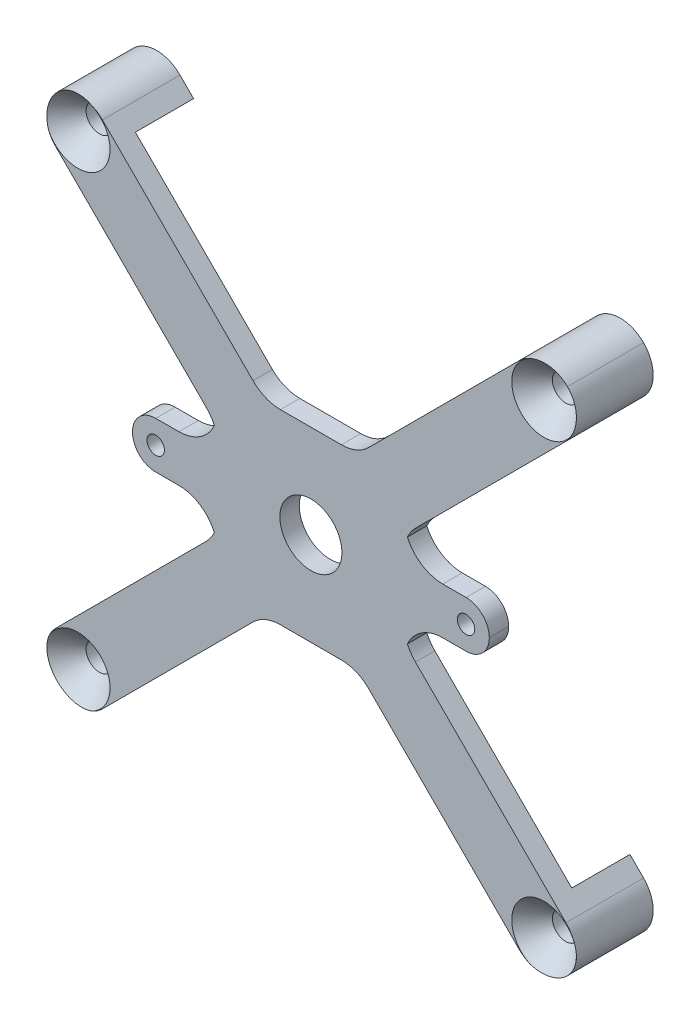
from build123d import *

# Parameters (mm, degrees)
BOSS_EXTRUDE1_DEPTH                            = 10
SKETCH3_W                                      = 46
SKETCH3_H                                      = 6
BOSS_EXTRUDE2_DEPTH                            = 10
CSK_FOR_4_OVAL_HEAD_MACHINE_SCREW1_D           = 3.4544
CSK_FOR_4_OVAL_HEAD_MACHINE_SCREW1_DEPTH       = 25
CSK_FOR_4_OVAL_HEAD_MACHINE_SCREW1_CSINK_D     = 8.3228434
CSK_FOR_4_OVAL_HEAD_MACHINE_SCREW1_CSINK_ANGLE = 82
CSK_FOR_4_OVAL_HEAD_MACHINE_SCREW1_TIP         = 1.037806461
SKETCH7_R                                      = 1.125
CUT_EXTRUDE1_DEPTH                             = 52.725839771
SKETCH8_R                                      = 4
CUT_EXTRUDE2_DEPTH                             = 52.725839771
FILLET1_R                                      = 4.25
FILLET2_R                                      = 3
FILLET3_R                                      = 5
SKETCH9_R                                      = 40
CUT_EXTRUDE3_DEPTH                             = 7.5


# Some blends are built 0.0001 mm under size
with BuildPart() as part:
    # Sketch2 → Boss-Extrude1 (new body)
    with BuildSketch(Plane.XY):
        Polygon((-6, 12.01040764), (-29.875261505, 35.885669145), (-35.885669145, 29.875261505), (-12.01040764, 6), (-12.01040764, -6), (-35.885669145, -29.875261505), (-29.875261505, -35.885669145), (-6, -12.01040764), (6, -12.01040764), (29.875261505, -35.885669145), (35.885669145, -29.875261505), (12.01040764, -6), (12.01040764, 6), (35.885669145, 29.875261505), (29.875261505, 35.885669145), (6, 12.01040764), align=None)
    extrude(amount=BOSS_EXTRUDE1_DEPTH)

    # Sketch3 → Boss-Extrude2 (add)
    with BuildSketch(Plane.XY):
        Rectangle(SKETCH3_W, SKETCH3_H)
    extrude(amount=BOSS_EXTRUDE2_DEPTH)

    # CSK for #4 Oval Head Machine Screw1
    with Locations(Plane.XY.offset(10)):
        with Locations((-30.0520382, 30.0520382), (30.0520382, 30.0520382), (30.0520382, -30.0520382), (-30.0520382, -30.0520382)):
            CounterSinkHole(CSK_FOR_4_OVAL_HEAD_MACHINE_SCREW1_D / 2, CSK_FOR_4_OVAL_HEAD_MACHINE_SCREW1_CSINK_D / 2, depth=CSK_FOR_4_OVAL_HEAD_MACHINE_SCREW1_DEPTH, counter_sink_angle=CSK_FOR_4_OVAL_HEAD_MACHINE_SCREW1_CSINK_ANGLE)
            with Locations((0, 0, -(CSK_FOR_4_OVAL_HEAD_MACHINE_SCREW1_DEPTH + CSK_FOR_4_OVAL_HEAD_MACHINE_SCREW1_TIP / 2))):  # 118° drill point
                Cone(0, CSK_FOR_4_OVAL_HEAD_MACHINE_SCREW1_D / 2, CSK_FOR_4_OVAL_HEAD_MACHINE_SCREW1_TIP, mode=Mode.SUBTRACT)

    # Sketch7 → Cut-Extrude1 (cut, through all)
    with BuildSketch(Plane.XY.offset(10)):
        with Locations((20, 0)):
            Circle(SKETCH7_R)
        with Locations((-20, 0)):
            Circle(SKETCH7_R)
    extrude(amount=-CUT_EXTRUDE1_DEPTH, mode=Mode.SUBTRACT)

    # Sketch8 → Cut-Extrude2 (cut, through all)
    with BuildSketch(Plane.XY.offset(10)):
        Circle(SKETCH8_R)
    extrude(amount=-CUT_EXTRUDE2_DEPTH, mode=Mode.SUBTRACT)

    # Fillet1
    # the kernel refuses this fillet: 4.25 mm, written as the material it takes off along each edge
    with BuildSketch(Plane(origin=(35.885669145, -29.875261505, -10.625), x_dir=(-0.7071067811865225, 0.7071067811865727, 0), z_dir=(0, 0, 1)), Plane(origin=(29.875261505, -35.885669145, -10.625), x_dir=(0.7071067811865693, 0.7071067811865258, 0), z_dir=(0, 0, 1)), Plane(origin=(29.875261505, 35.885669145, -10.625), x_dir=(-0.7071067811865508, -0.7071067811865441, 0), z_dir=(0, 0, 1)), Plane(origin=(35.885669145, 29.875261505, -10.625), x_dir=(-0.7071067811889081, 0.7071067811841868, 0), z_dir=(0, 0, 1))) as fillet1_piece_1:
        with BuildLine():
            CenterArc((FILLET1_R, FILLET1_R), FILLET1_R, 180, 90)
            Line((0, FILLET1_R), (0, 0))
            Line((0, 0), (FILLET1_R, 0))
        make_face()
    extrude(amount=31.25, mode=Mode.SUBTRACT)
    with BuildSketch(Plane(origin=(-29.875261505, 35.885669145, -10.625), x_dir=(0.7071067811862382, -0.7071067811868568, 0), z_dir=(0, 0, 1)), Plane(origin=(-35.885669145, 29.875261505, -10.625), x_dir=(0.7071067811865512, 0.7071067811865438, 0), z_dir=(0, 0, 1)), Plane(origin=(-35.885669145, -29.875261505, -10.625), x_dir=(0.7071067811865503, 0.7071067811865446, 0), z_dir=(0, 0, 1)), Plane(origin=(-29.875261505, -35.885669145, -10.625), x_dir=(-0.7071067811865447, 0.7071067811865505, 0), z_dir=(0, 0, 1))) as fillet1_piece_2:
        with BuildLine():
            CenterArc((FILLET1_R, -FILLET1_R), FILLET1_R, 90, 90)
            Line((0, -FILLET1_R), (0, 0))
            Line((0, 0), (FILLET1_R, 0))
        make_face()
    extrude(amount=31.25, mode=Mode.SUBTRACT)

    # Fillet2
    fillet2_edges = [part.edges().sort_by_distance(p)[0] for p in [
        (23, 3, 5),
        (23, -3, 5),
        (-23, 3, 5),
        (-23, -3, 5),
    ]]
    fillet(fillet2_edges, radius=FILLET2_R - 0.0001)  # a hair under: the kernel refuses the full size

    # Fillet3
    # the kernel refuses this fillet: 5 mm, written as the material it adds along each edge
    with BuildSketch(Plane(origin=(-6, 12.01040764, 0), x_dir=(1, 0, 0), z_dir=(0, 0, 1)), Plane(origin=(6, 12.01040764, 0), x_dir=(0.7071067811865509, 0.707106781186544, 0), z_dir=(0, 0, 1)), Plane(origin=(-12.01040764, 6, 0), x_dir=(-0.7071067811865444, 0.7071067811865508, 0), z_dir=(0, 0, 1)), Plane(origin=(12.01040764, 6, 0), x_dir=(0, -1, 0), z_dir=(0, 0, 1))) as fillet3_piece_1:
        with BuildLine():
            CenterArc((FILLET3_R * 0.414213562373, FILLET3_R), FILLET3_R, 225, 45)
            Line((-FILLET3_R * 0.292893218814, FILLET3_R * 0.292893218814), (0, 0))
            Line((0, 0), (FILLET3_R * 0.414213562373, 0))
        make_face()
    extrude(amount=10)
    with BuildSketch(Plane(origin=(-12.01040764, 3, 0), x_dir=(0, 1, 0), z_dir=(0, 0, 1)), Plane(origin=(-12.01040764, -3, 10), x_dir=(0, -1, 0), z_dir=(0, 0, -1))) as fillet3_piece_2:
        with BuildLine():
            CenterArc((FILLET3_R, FILLET3_R), FILLET3_R, 180, 90)
            Line((0, FILLET3_R), (0, 0))
            Line((0, 0), (FILLET3_R, 0))
        make_face()
    extrude(amount=10)
    with BuildSketch(Plane(origin=(-12.01040764, -6, 0), x_dir=(-0.7071067811865506, -0.7071067811865446, 0), z_dir=(0, 0, 1)), Plane(origin=(-6, -12.01040764, 0), x_dir=(1, 0, 0), z_dir=(0, 0, 1)), Plane(origin=(6, -12.01040764, 0), x_dir=(0.7071067811861392, -0.7071067811869558, 0), z_dir=(0, 0, 1)), Plane(origin=(12.01040764, -6, 0), x_dir=(0, 1, 0), z_dir=(0, 0, 1))) as fillet3_piece_3:
        with BuildLine():
            CenterArc((FILLET3_R * 0.414213562373, -FILLET3_R), FILLET3_R, 90, 45)
            Line((-FILLET3_R * 0.292893218813, -FILLET3_R * 0.292893218813), (0, 0))
            Line((0, 0), (FILLET3_R * 0.414213562373, 0))
        make_face()
    extrude(amount=10)
    with BuildSketch(Plane(origin=(12.01040764, -3, 0), x_dir=(1, 0, 0), z_dir=(0, 0, 1)), Plane(origin=(12.01040764, 3, 10), x_dir=(1, 0, 0), z_dir=(0, 0, -1))) as fillet3_piece_4:
        with BuildLine():
            CenterArc((FILLET3_R, -FILLET3_R), FILLET3_R, 90, 90)
            Line((0, -FILLET3_R), (0, 0))
            Line((0, 0), (FILLET3_R, 0))
        make_face()
    extrude(amount=10)

    # Sketch9 → Cut-Extrude3 (cut)
    with BuildSketch(Plane(origin=(0, 0, 0), x_dir=(-1, 0, 0), z_dir=(0, 0, -1))):
        Circle(SKETCH9_R)
    extrude(amount=-CUT_EXTRUDE3_DEPTH, mode=Mode.SUBTRACT)


solid = part.part
